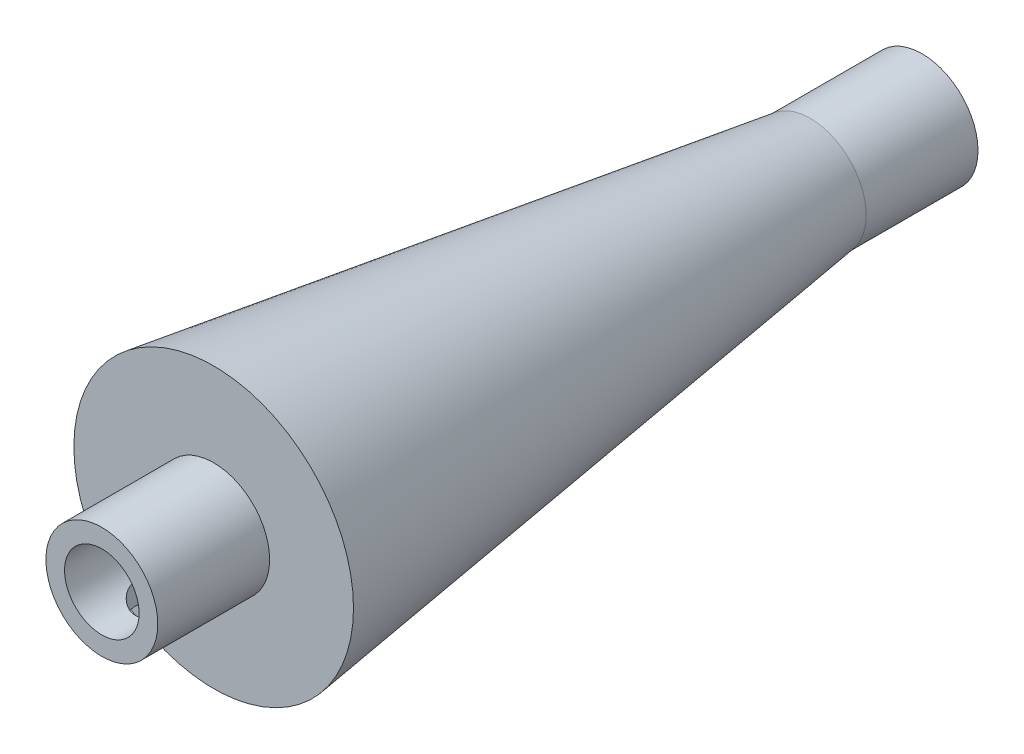
from build123d import *

# Parameters (mm, degrees)
F_6_CLEARANCE_HOLE1_D     = 3.7973
F_6_CLEARANCE_HOLE1_DEPTH = 6.35
F_6_CLEARANCE_HOLE1_TIP   = 1.140824014


with BuildPart() as part:
    # Sketch1 → Revolve1 (revolve)
    with BuildSketch(Plane(origin=(0, 0, 0), x_dir=(1, 0, 0), z_dir=(0, 1, 0))):
        Polygon((4.7625, 14.443299572), (4.7625, 23.968299572), (11.90625, 23.968299572), (4.7625, 74.768299572), (4.7625, 84.293299572), (3.175, 84.293299572), (3.175, 14.443299572), align=None)
    revolve(axis=Axis((0, 0, 1.5875), (0, 0, -1)))

    # #6 Clearance Hole1
    with Locations(Plane(origin=(0, -4.7625, 0), x_dir=(-1, 0, 0), z_dir=(0, -1, 0))):
        with Locations((0, 79.530799572), (0, 19.205799572)):
            Hole(F_6_CLEARANCE_HOLE1_D / 2, depth=F_6_CLEARANCE_HOLE1_DEPTH)
            with Locations((0, 0, -(F_6_CLEARANCE_HOLE1_DEPTH + F_6_CLEARANCE_HOLE1_TIP / 2))):  # 118° drill point
                Cone(0, F_6_CLEARANCE_HOLE1_D / 2, F_6_CLEARANCE_HOLE1_TIP, mode=Mode.SUBTRACT)


solid = part.part
